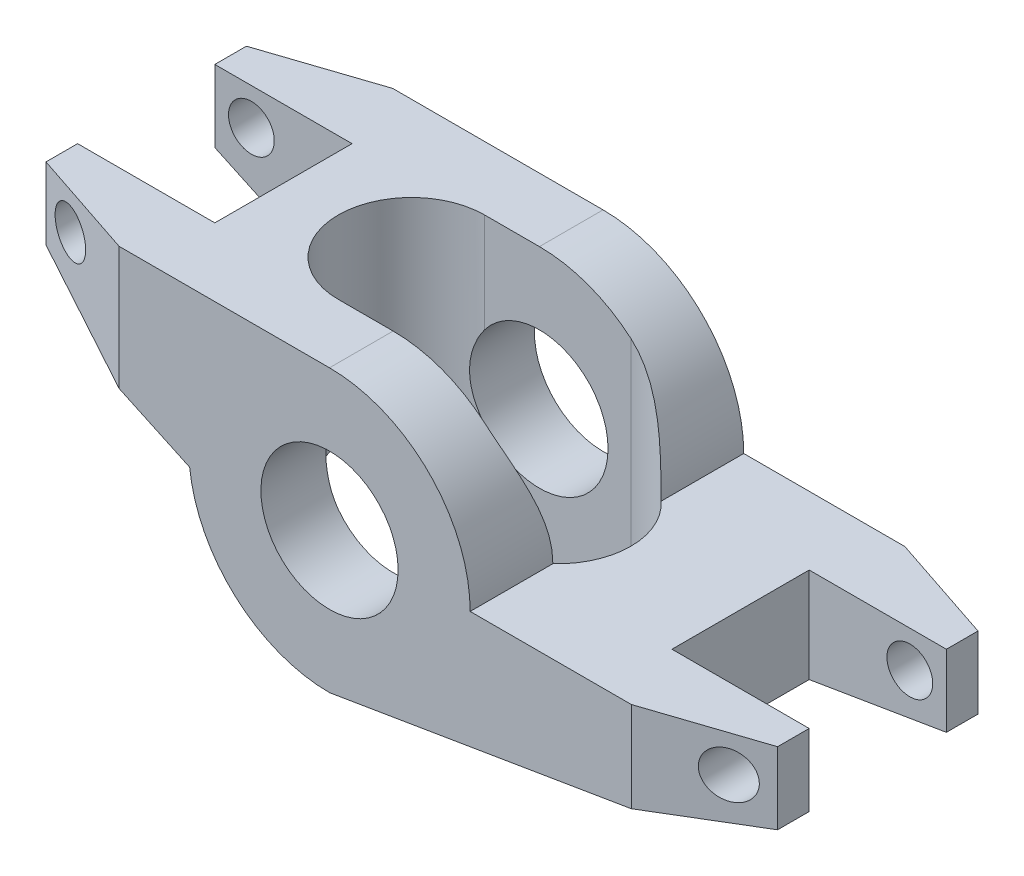
from build123d import *

# Parameters (mm, degrees)
SKETCH1_R           = 4.765
SKETCH1_R_2         = 1.59
BOSS_EXTRUDE1_DEPTH = 9.5
CHAMFER1_SIZE       = 2.54
CHAMFER1_SIZE_2     = 7.62
CHAMFER2_SIZE       = 7.62
CHAMFER2_SIZE_2     = 2.54
SKETCH2_W           = 9.53
SKETCH2_H           = 9.53
CUT_EXTRUDE1_DEPTH  = 56.26045331
CUT_EXTRUDE2_DEPTH  = 56.26045331


with BuildPart() as part:
    # Sketch1 → Boss-Extrude1 (new, symmetric)
    with BuildSketch(Plane.XY):
        with BuildLine():
            Line((0, 0), (0, -5))
            Line((0, -5), (12.518490754, -10.837468107))
            ThreePointArc((12.518490754, -10.837468107), (15.709887401, -17.046058803), (22.23, -19.54))
            Line((22.23, -19.54), (50.81, -14.77))
            Line((50.81, -14.77), (50.81, -9.77))
            Line((50.81, -9.77), (32, -9.77))
            ThreePointArc((32, -9.77), (29.138433252, -2.861566748), (22.23, 0))
            Line((22.23, 0), (0, 0))
        make_face()
        with Locations((22.23, -9.77)):
            Circle(SKETCH1_R, mode=Mode.SUBTRACT)
        with Locations((2.54, -2.54)):
            Circle(SKETCH1_R_2, mode=Mode.SUBTRACT)
        with Locations((48.27, -12.31)):
            Circle(SKETCH1_R_2, mode=Mode.SUBTRACT)
    extrude(amount=BOSS_EXTRUDE1_DEPTH, both=True)

    # Chamfer1
    # the kernel refuses this chamfer: 7.62, 2.54 mm, written as the material it takes off along each edge
    with BuildSketch(Plane(origin=(0, 19.774364901, -9.5), x_dir=(-0.10902612017980703, 0, 0.9940388851139267), z_dir=(0, -1, 0))) as chamfer1_piece_1:
        Polygon((CHAMFER1_SIZE * 0.994038885114, -CHAMFER1_SIZE * 0.10902612018), (-CHAMFER1_SIZE_2 * 0.10902612018, -CHAMFER1_SIZE_2 * 0.994038885114), (0, 0), align=None)
    extrude(amount=44.548729802, mode=Mode.SUBTRACT)
    with BuildSketch(Plane(origin=(0, 19.774364901, 9.5), x_dir=(-0.10902612017980703, 0, -0.9940388851139267), z_dir=(0, -1, 0)), Plane(origin=(50.81, -34.544364901, 9.5), x_dir=(0.10902612017980588, 0, -0.9940388851139268), z_dir=(0, 1, 0))) as chamfer1_piece_2:
        Polygon((CHAMFER1_SIZE * 0.994038885114, CHAMFER1_SIZE * 0.10902612018), (-CHAMFER1_SIZE_2 * 0.10902612018, CHAMFER1_SIZE_2 * 0.994038885114), (0, 0), align=None)
    extrude(amount=44.548729802, mode=Mode.SUBTRACT)

    # Chamfer2
    # the kernel refuses this chamfer: 7.62, 2.54 mm, written as the material it takes off along each edge
    with BuildSketch(Plane(origin=(50.81, -34.544364901, -9.5), x_dir=(-0.9999257509361694, 0, -0.01218575458219919), z_dir=(0, 1, 0))) as chamfer2_piece_1:
        Polygon((CHAMFER2_SIZE * 0.999925750936, CHAMFER2_SIZE * 0.0121857545822), (-CHAMFER2_SIZE_2 * 0.0121857545822, CHAMFER2_SIZE_2 * 0.999925750936), (0, 0), align=None)
    extrude(amount=44.548729802, mode=Mode.SUBTRACT)

    # Sketch2 → Cut-Extrude1 (cut, through all)
    with BuildSketch(Plane(origin=(0, 0, 0), x_dir=(1, 0, 0), z_dir=(0, 1, 0))):
        with Locations((4.765, 0)):
            Rectangle(SKETCH2_W, SKETCH2_H)
        with Locations((46.045, 0)):
            Rectangle(SKETCH2_W, SKETCH2_H)
    extrude(amount=-CUT_EXTRUDE1_DEPTH, mode=Mode.SUBTRACT)

    # Sketch3 → Cut-Extrude2 (cut, through all)
    with BuildSketch(Plane(origin=(0, 0, 0), x_dir=(1, 0, 0), z_dir=(0, 1, 0))):
        with BuildLine():
            Line((18.42, 5.08), (28.58, 5.08))
            ThreePointArc((28.58, 5.08), (33.66, 0), (28.58, -5.08))
            Line((28.58, -5.08), (18.42, -5.08))
            ThreePointArc((18.42, -5.08), (13.34, 0), (18.42, 5.08))
        make_face()
    extrude(amount=-CUT_EXTRUDE2_DEPTH, mode=Mode.SUBTRACT)


solid = part.part
